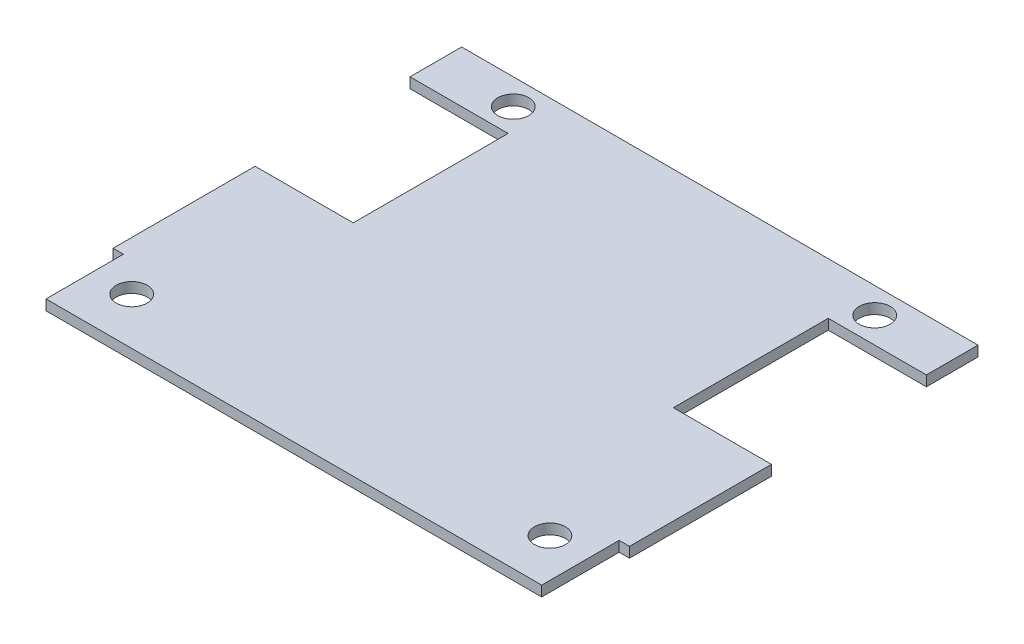
from build123d import *

# Parameters (mm, degrees)
CROQUIS3_R              = 6
SALIENTE_EXTRUIR1_DEPTH = 4
CORTAR_EXTRUIR1_REACH   = 131.701
CROQUIS4_W              = 4
CROQUIS4_H              = 30
CROQUIS6_R              = 6
CORTAR_EXTRUIR2_DEPTH   = 10


with BuildPart() as part:
    # Croquis3 → Saliente-Extruir1 (new body)
    with BuildSketch(Plane(origin=(0, 0, 0), x_dir=(1, 0, 0), z_dir=(0, 1, 0))):
        Polygon((100, 82.5), (-100, 82.5), (-100, 62.5), (-62, 62.5), (-62, 2.5), (-100, 2.5), (-100, -82.5), (100, -82.5), (100, 2.5), (62, 2.5), (62, 62.5), (100, 62.5), align=None)
        with Locations((-70, 72.5)):
            Circle(CROQUIS3_R, mode=Mode.SUBTRACT)
        with Locations((70, 72.5)):
            Circle(CROQUIS3_R, mode=Mode.SUBTRACT)
    extrude(amount=SALIENTE_EXTRUIR1_DEPTH)

    # Croquis4 → Cortar-Extruir1 (cut, up to next)
    with BuildSketch(Plane(origin=(0, 4, 0), x_dir=(1, 0, 0), z_dir=(0, 1, 0)), mode=Mode.PRIVATE) as cortar_extruir1_sk1:
        with Locations((98, -67.5)):
            Rectangle(CROQUIS4_W, CROQUIS4_H)
    cortar_extruir1_tool1 = extrude(cortar_extruir1_sk1.sketch, amount=-CORTAR_EXTRUIR1_REACH, mode=Mode.PRIVATE) & part.part
    # Croquis4 → Cortar-Extruir1 (cut, up to next)
    with BuildSketch(Plane(origin=(0, 4, 0), x_dir=(1, 0, 0), z_dir=(0, 1, 0)), mode=Mode.PRIVATE) as cortar_extruir1_sk2:
        with Locations((-98, -67.5)):
            Rectangle(CROQUIS4_W, CROQUIS4_H)
    cortar_extruir1_tool2 = extrude(cortar_extruir1_sk2.sketch, amount=-CORTAR_EXTRUIR1_REACH, mode=Mode.PRIVATE) & part.part
    add(cortar_extruir1_tool1.solids().sort_by_distance((98, 4, 67.5))[0], mode=Mode.SUBTRACT)
    add(cortar_extruir1_tool2.solids().sort_by_distance((-98, 4, 67.5))[0], mode=Mode.SUBTRACT)

    # Croquis6 → Cortar-Extruir2 (cut)
    with BuildSketch(Plane(origin=(0, 4, 0), x_dir=(1, 0, 0), z_dir=(0, 1, 0))):
        with Locations((-81, -64.309221376)):
            Circle(CROQUIS6_R)
        with Locations((81, -64.309221376)):
            Circle(CROQUIS6_R)
    extrude(amount=-CORTAR_EXTRUIR2_DEPTH, mode=Mode.SUBTRACT)


solid = part.part
